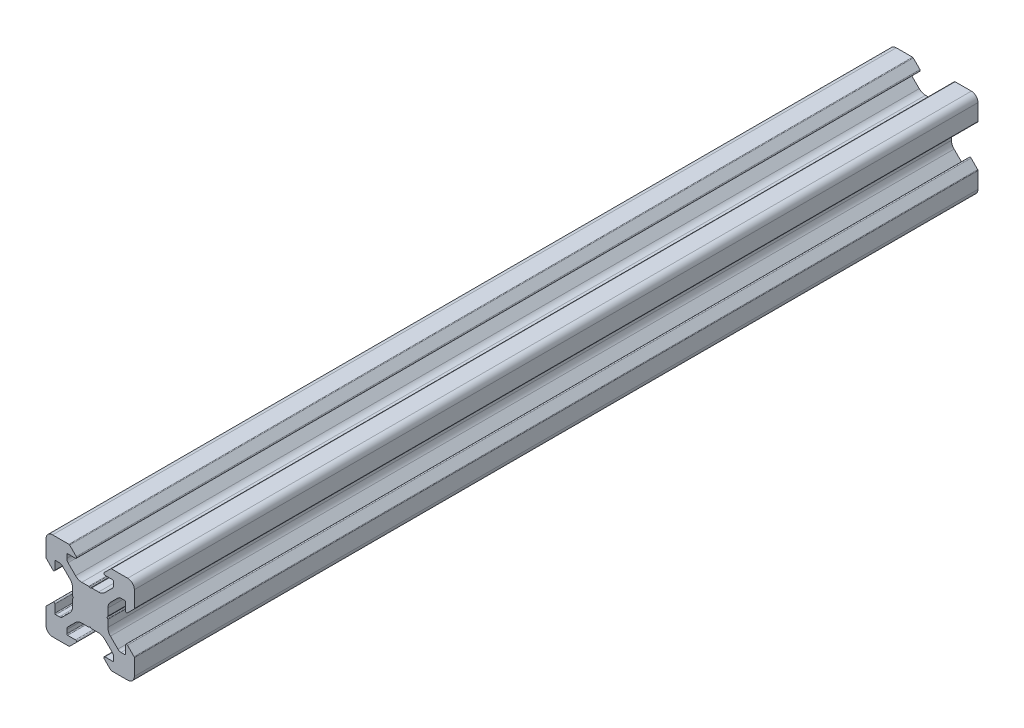
from build123d import *

# Parameters (mm, degrees)
EXTRUDE_1_DEPTH = 191


# Read off the part's stored shape, not the designer's step: 222 Конструкционный профиль 20х20-1-surface1
with BuildPart() as part:
    # Эскиз1 → Бобышка-Вытянуть1 (new body)
    with BuildSketch(Plane.XY):
        with BuildLine():
            Line((-3.945217202, 0.181521503), (-3.8, 0))
            Line((-3.8, 0), (-3.945217202, -0.181521503))
            ThreePointArc((-3.945217202, -0.181521503), (-3.98590708, -0.254943529), (-4, -0.337695265))
            Line((-4, -0.337695265), (-4, -1.898780669))
            ThreePointArc((-4, -1.898780669), (-4.152240935, -2.664147534), (-4.585786438, -3.312994231))
            Line((-4.585786438, -3.312994231), (-6.279898987, -5.007106781))
            ThreePointArc((-6.279898987, -5.007106781), (-6.604322336, -5.223879533), (-6.987005769, -5.3))
            Line((-6.987005769, -5.3), (-7.8, -5.3))
            ThreePointArc((-7.8, -5.3), (-7.941421356, -5.241421356), (-8, -5.1))
            Line((-8, -5.1), (-8, -3.33))
            ThreePointArc((-8, -3.33), (-8.154329142, -3.099030117), (-8.426776695, -3.153223305))
            Line((-8.426776695, -3.153223305), (-9.926776695, -4.653223305))
            ThreePointArc((-9.926776695, -4.653223305), (-9.980969883, -4.734329142), (-10, -4.83))
            Line((-10, -4.83), (-10, -8.5))
            ThreePointArc((-10, -8.5), (-9.560660172, -9.560660172), (-8.5, -10))
            Line((-8.5, -10), (-4.83, -10))
            ThreePointArc((-4.83, -10), (-4.734329142, -9.980969883), (-4.653223305, -9.926776695))
            Line((-4.653223305, -9.926776695), (-3.153223305, -8.426776695))
            ThreePointArc((-3.153223305, -8.426776695), (-3.099030117, -8.154329142), (-3.33, -8))
            Line((-3.33, -8), (-5.1, -8))
            ThreePointArc((-5.1, -8), (-5.241421356, -7.941421356), (-5.3, -7.8))
            Line((-5.3, -7.8), (-5.3, -6.987005769))
            ThreePointArc((-5.3, -6.987005769), (-5.223879533, -6.604322336), (-5.007106781, -6.279898987))
            Line((-5.007106781, -6.279898987), (-3.312994231, -4.585786438))
            ThreePointArc((-3.312994231, -4.585786438), (-2.664147534, -4.152240935), (-1.898780669, -4))
            Line((-1.898780669, -4), (-0.337695265, -4))
            ThreePointArc((-0.337695265, -4), (-0.254943529, -3.98590708), (-0.181521503, -3.945217202))
            Line((-0.181521503, -3.945217202), (0, -3.8))
            Line((0, -3.8), (0.181521503, -3.945217202))
            ThreePointArc((0.181521503, -3.945217202), (0.254943529, -3.98590708), (0.337695265, -4))
            Line((0.337695265, -4), (1.898780669, -4))
            ThreePointArc((1.898780669, -4), (2.664147534, -4.152240935), (3.312994231, -4.585786438))
            Line((3.312994231, -4.585786438), (5.007106781, -6.279898987))
            ThreePointArc((5.007106781, -6.279898987), (5.223879533, -6.604322336), (5.3, -6.987005769))
            Line((5.3, -6.987005769), (5.3, -7.8))
            ThreePointArc((5.3, -7.8), (5.241421356, -7.941421356), (5.1, -8))
            Line((5.1, -8), (3.33, -8))
            ThreePointArc((3.33, -8), (3.099030117, -8.154329142), (3.153223305, -8.426776695))
            Line((3.153223305, -8.426776695), (4.653223305, -9.926776695))
            ThreePointArc((4.653223305, -9.926776695), (4.734329142, -9.980969883), (4.83, -10))
            Line((4.83, -10), (8.5, -10))
            ThreePointArc((8.5, -10), (9.560660172, -9.560660172), (10, -8.5))
            Line((10, -8.5), (10, -4.83))
            ThreePointArc((10, -4.83), (9.980969883, -4.734329142), (9.926776695, -4.653223305))
            Line((9.926776695, -4.653223305), (8.426776695, -3.153223305))
            ThreePointArc((8.426776695, -3.153223305), (8.154329142, -3.099030117), (8, -3.33))
            Line((8, -3.33), (8, -5.1))
            ThreePointArc((8, -5.1), (7.941421356, -5.241421356), (7.8, -5.3))
            Line((7.8, -5.3), (6.987005769, -5.3))
            ThreePointArc((6.987005769, -5.3), (6.604322336, -5.223879533), (6.279898987, -5.007106781))
            Line((6.279898987, -5.007106781), (4.585786438, -3.312994231))
            ThreePointArc((4.585786438, -3.312994231), (4.152240935, -2.664147534), (4, -1.898780669))
            Line((4, -1.898780669), (4, -0.337695265))
            ThreePointArc((4, -0.337695265), (3.98590708, -0.254943529), (3.945217202, -0.181521503))
            Line((3.945217202, -0.181521503), (3.8, 0))
            Line((3.8, 0), (3.945217202, 0.181521503))
            ThreePointArc((3.945217202, 0.181521503), (3.98590708, 0.254943529), (4, 0.337695265))
            Line((4, 0.337695265), (4, 1.898780669))
            ThreePointArc((4, 1.898780669), (4.152240935, 2.664147534), (4.585786438, 3.312994231))
            Line((4.585786438, 3.312994231), (6.279898987, 5.007106781))
            ThreePointArc((6.279898987, 5.007106781), (6.604322336, 5.223879533), (6.987005769, 5.3))
            Line((6.987005769, 5.3), (7.8, 5.3))
            ThreePointArc((7.8, 5.3), (7.941421356, 5.241421356), (8, 5.1))
            Line((8, 5.1), (8, 3.33))
            ThreePointArc((8, 3.33), (8.154329142, 3.099030117), (8.426776695, 3.153223305))
            Line((8.426776695, 3.153223305), (9.926776695, 4.653223305))
            ThreePointArc((9.926776695, 4.653223305), (9.980969883, 4.734329142), (10, 4.83))
            Line((10, 4.83), (10, 8.5))
            ThreePointArc((10, 8.5), (9.560660172, 9.560660172), (8.5, 10))
            Line((8.5, 10), (4.83, 10))
            ThreePointArc((4.83, 10), (4.734329142, 9.980969883), (4.653223305, 9.926776695))
            Line((4.653223305, 9.926776695), (3.153223305, 8.426776695))
            ThreePointArc((3.153223305, 8.426776695), (3.099030117, 8.154329142), (3.33, 8))
            Line((3.33, 8), (5.1, 8))
            ThreePointArc((5.1, 8), (5.241421356, 7.941421356), (5.3, 7.8))
            Line((5.3, 7.8), (5.3, 6.987005769))
            ThreePointArc((5.3, 6.987005769), (5.223879533, 6.604322336), (5.007106781, 6.279898987))
            Line((5.007106781, 6.279898987), (3.312994231, 4.585786438))
            ThreePointArc((3.312994231, 4.585786438), (2.664147534, 4.152240935), (1.898780669, 4))
            Line((1.898780669, 4), (0.337695265, 4))
            ThreePointArc((0.337695265, 4), (0.254943529, 3.98590708), (0.181521503, 3.945217202))
            Line((0.181521503, 3.945217202), (0, 3.8))
            Line((0, 3.8), (-0.181521503, 3.945217202))
            ThreePointArc((-0.181521503, 3.945217202), (-0.254943529, 3.98590708), (-0.337695265, 4))
            Line((-0.337695265, 4), (-1.898780669, 4))
            ThreePointArc((-1.898780669, 4), (-2.664147534, 4.152240935), (-3.312994231, 4.585786438))
            Line((-3.312994231, 4.585786438), (-5.007106781, 6.279898987))
            ThreePointArc((-5.007106781, 6.279898987), (-5.223879533, 6.604322336), (-5.3, 6.987005769))
            Line((-5.3, 6.987005769), (-5.3, 7.8))
            ThreePointArc((-5.3, 7.8), (-5.241421356, 7.941421356), (-5.1, 8))
            Line((-5.1, 8), (-3.33, 8))
            ThreePointArc((-3.33, 8), (-3.099030117, 8.154329142), (-3.153223305, 8.426776695))
            Line((-3.153223305, 8.426776695), (-4.653223305, 9.926776695))
            ThreePointArc((-4.653223305, 9.926776695), (-4.734329142, 9.980969883), (-4.83, 10))
            Line((-4.83, 10), (-8.5, 10))
            ThreePointArc((-8.5, 10), (-9.560660172, 9.560660172), (-10, 8.5))
            Line((-10, 8.5), (-10, 4.83))
            ThreePointArc((-10, 4.83), (-9.980969883, 4.734329142), (-9.926776695, 4.653223305))
            Line((-9.926776695, 4.653223305), (-8.426776695, 3.153223305))
            ThreePointArc((-8.426776695, 3.153223305), (-8.154329142, 3.099030117), (-8, 3.33))
            Line((-8, 3.33), (-8, 5.1))
            ThreePointArc((-8, 5.1), (-7.941421356, 5.241421356), (-7.8, 5.3))
            Line((-7.8, 5.3), (-6.987005769, 5.3))
            ThreePointArc((-6.987005769, 5.3), (-6.604322336, 5.223879533), (-6.279898987, 5.007106781))
            Line((-6.279898987, 5.007106781), (-4.585786438, 3.312994231))
            ThreePointArc((-4.585786438, 3.312994231), (-4.152240935, 2.664147534), (-4, 1.898780669))
            Line((-4, 1.898780669), (-4, 0.337695265))
            ThreePointArc((-4, 0.337695265), (-3.98590708, 0.254943529), (-3.945217202, 0.181521503))
        make_face()
    extrude(amount=EXTRUDE_1_DEPTH)


solid = part.part
